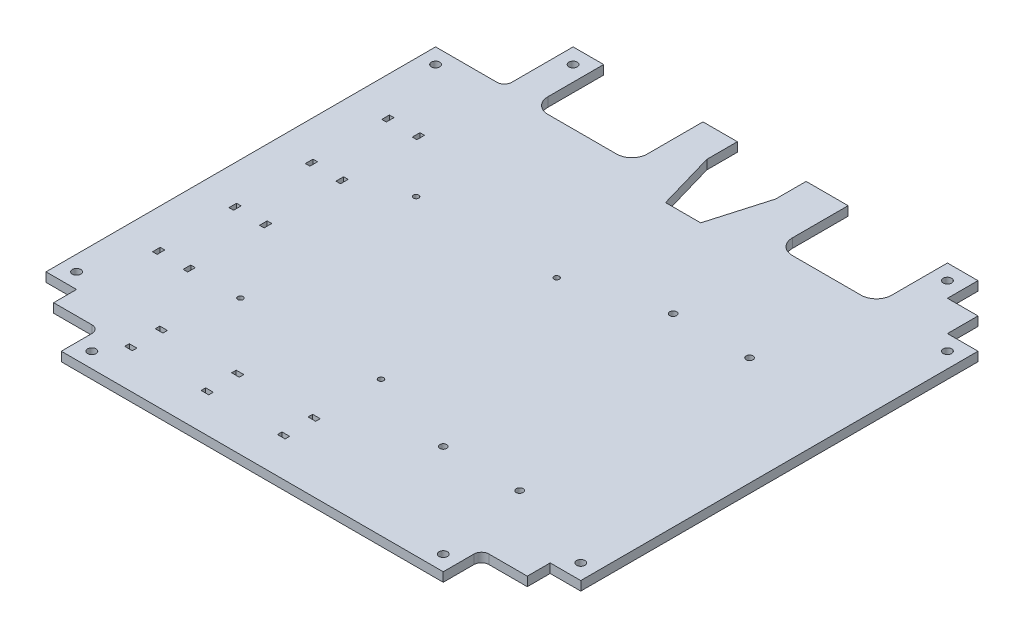
from build123d import *

# Parameters (mm, degrees)
SKETCH1_W            = 350
SKETCH1_H            = 340
BOSS_EXTRUDE1_DEPTH  = 6
CUT_EXTRUDE2_DEPTH   = 6
MIRROR2_COPY_1_DEPTH = 6
CUT_EXTRUDE3_DEPTH   = 6
SKETCH4_W            = 10
SKETCH4_H            = 82.256980738
CUT_EXTRUDE4_DEPTH   = 6
SKETCH5_R            = 2.25
SKETCH5_R_2          = 1.75
CUT_EXTRUDE5_DEPTH   = 6
SKETCH6_W            = 12
SKETCH6_H            = 9
CUT_EXTRUDE6_DEPTH   = 6
SKETCH8_W            = 5
SKETCH8_H            = 3
CUT_EXTRUDE7_DEPTH   = 6
LPATTERN1_COUNT      = 3
LPATTERN1_PITCH      = 50
SKETCH9_W            = 3
SKETCH9_H            = 5
CUT_EXTRUDE8_DEPTH   = 6
LPATTERN2_COUNT      = 4
LPATTERN2_PITCH      = 50
SKETCH10_W           = 30
SKETCH10_H           = 25
CUT_EXTRUDE9_DEPTH   = 6
SKETCH11_W           = 10
SKETCH11_H           = 51.49656536
CUT_EXTRUDE10_DEPTH  = 6
SKETCH12_W           = 45
SKETCH12_H           = 45
CUT_EXTRUDE11_DEPTH  = 6
FILLET2_R            = 4.9
SKETCH13_R           = 2.75
CUT_EXTRUDE12_DEPTH  = 6
SKETCH14_W           = 50
SKETCH14_H           = 20
SKETCH14_W_2         = 40
CUT_EXTRUDE13_DEPTH  = 10
FILLET4_R            = 5
FILLET5_R            = 5
SKETCH15_W           = 65
SKETCH15_H           = 46.515736948
CUT_EXTRUDE14_DEPTH  = 10
FILLET6_R            = 10


with BuildPart() as part:
    # Sketch1 → Boss-Extrude1 (new body)
    with BuildSketch(Plane(origin=(0, 0, 0), x_dir=(1, 0, 0), z_dir=(0, 1, 0))):
        Rectangle(SKETCH1_W, SKETCH1_H)
    extrude(amount=BOSS_EXTRUDE1_DEPTH)

    # Sketch2 → Cut-Extrude2 (cut)
    with BuildSketch(Plane(origin=(0, 6, 0), x_dir=(1, 0, 0), z_dir=(0, 1, 0))):
        Polygon((-175, -130), (-155, -130), (-155, -150), (-135, -150), (-135, -170), (-175, -170), align=None)
    cut_extrude2 = extrude(amount=-CUT_EXTRUDE2_DEPTH, mode=Mode.SUBTRACT)

    # Mirror1: Cut-Extrude2 across plane
    add(cut_extrude2.mirror(Plane.XY), mode=Mode.SUBTRACT)

    # Mirror2: Cut-Extrude2 across plane
    add(cut_extrude2.mirror(Plane(origin=(0, 0, 0), x_dir=(0, 0, 1), z_dir=(1, 0, 0))), mode=Mode.SUBTRACT)

    # Mirror2 copy 1 sketch → Mirror2 copy 1 (cut)
    with BuildSketch(Plane(origin=(0, 6, 0), x_dir=(-1, 0, 0), z_dir=(0, 1, 0))):
        Polygon((-175, -130), (-155, -130), (-155, -150), (-135, -150), (-135, -170), (-175, -170), align=None)
    extrude(amount=-MIRROR2_COPY_1_DEPTH, mode=Mode.SUBTRACT)

    # Sketch3 → Cut-Extrude3 (cut)
    with BuildSketch(Plane(origin=(0, 6, 0), x_dir=(1, 0, 0), z_dir=(0, 1, 0))):
        Polygon((-22.5, 170), (-22.5, 150), (-11.5, 112), (11.5, 112), (22.5, 150), (22.5, 170), align=None)
    extrude(amount=-CUT_EXTRUDE3_DEPTH, mode=Mode.SUBTRACT)

    # Sketch4 → Cut-Extrude4 (cut)
    with BuildSketch(Plane(origin=(0, 6, 0), x_dir=(1, 0, 0), z_dir=(0, 1, 0))):
        with Locations((-97.5, 165.128490369)):
            Rectangle(SKETCH4_W, SKETCH4_H)
        with Locations((97.5, 165.128490369)):
            Rectangle(SKETCH4_W, SKETCH4_H)
    extrude(amount=-CUT_EXTRUDE4_DEPTH, mode=Mode.SUBTRACT)

    # Sketch5 → Cut-Extrude5 (cut)
    with BuildSketch(Plane(origin=(0, 6, 0), x_dir=(1, 0, 0), z_dir=(0, 1, 0))):
        with Locations(Location((104, 51.5, 0), (0, 0, 270))):
            Circle(SKETCH5_R)
        with Locations(Location((104, -99, 0), (0, 0, 270))):
            Circle(SKETCH5_R)
        with Locations(Location((54, -99, 0), (0, 0, 270))):
            Circle(SKETCH5_R)
        with Locations(Location((54, 51.5, 0), (0, 0, 270))):
            Circle(SKETCH5_R)
        with Locations(Location((-4.5, 33.75, 0), (0, 0, 270))):
            Circle(SKETCH5_R_2)
        with Locations(Location((-4.5, -81.25, 0), (0, 0, 270))):
            Circle(SKETCH5_R_2)
        with Locations(Location((-96.5, -81.25, 0), (0, 0, 270))):
            Circle(SKETCH5_R_2)
        with Locations(Location((-96.5, 33.75, 0), (0, 0, 270))):
            Circle(SKETCH5_R_2)
    extrude(amount=-CUT_EXTRUDE5_DEPTH, mode=Mode.SUBTRACT)

    # Sketch6 → Cut-Extrude6 (cut)
    with BuildSketch(Plane(origin=(0, 6, 0), x_dir=(1, 0, 0), z_dir=(0, 1, 0))):
        with Locations((-97.5, 145.5)):
            Rectangle(SKETCH6_W, SKETCH6_H)
        with Locations((97.5, 145.5)):
            Rectangle(SKETCH6_W, SKETCH6_H)
    extrude(amount=-CUT_EXTRUDE6_DEPTH, mode=Mode.SUBTRACT)

    # Sketch8 → Cut-Extrude7 (cut)
    with BuildSketch(Plane(origin=(0, 6, 0), x_dir=(1, 0, 0), z_dir=(0, 1, 0))):
        with Locations((-4.5, -125)):
            Rectangle(SKETCH8_W, SKETCH8_H)
        with Locations((-4.5, -145)):
            Rectangle(SKETCH8_W, SKETCH8_H)
    cut_extrude7 = extrude(amount=-CUT_EXTRUDE7_DEPTH, mode=Mode.SUBTRACT)

    # LPattern1: Cut-Extrude7 ×3
    with Locations(*[(-i * LPATTERN1_PITCH, 0, 0) for i in range(1, LPATTERN1_COUNT)]):
        add(cut_extrude7, mode=Mode.SUBTRACT)

    # Sketch9 → Cut-Extrude8 (cut)
    with BuildSketch(Plane(origin=(0, 6, 0), x_dir=(1, 0, 0), z_dir=(0, 1, 0))):
        with Locations((-150, -81.25)):
            Rectangle(SKETCH9_W, SKETCH9_H)
        with Locations((-130, -81.25)):
            Rectangle(SKETCH9_W, SKETCH9_H)
    cut_extrude8 = extrude(amount=-CUT_EXTRUDE8_DEPTH, mode=Mode.SUBTRACT)

    # LPattern2: Cut-Extrude8 ×4
    with Locations(*[(0, 0, -i * LPATTERN2_PITCH) for i in range(1, LPATTERN2_COUNT)]):
        add(cut_extrude8, mode=Mode.SUBTRACT)

    # Sketch10 → Cut-Extrude9 (cut)
    with BuildSketch(Plane(origin=(0, 6, 0), x_dir=(1, 0, 0), z_dir=(0, 1, 0))):
        with Locations((140, -157.5)):
            Rectangle(SKETCH10_W, SKETCH10_H)
    cut_extrude9 = extrude(amount=-CUT_EXTRUDE9_DEPTH, mode=Mode.SUBTRACT)

    # Mirror3: Cut-Extrude9 across plane
    add(cut_extrude9.mirror(Plane(origin=(0, 0, 0), x_dir=(0, 0, 1), z_dir=(1, 0, 0))), mode=Mode.SUBTRACT)

    # Sketch11 → Cut-Extrude10 (cut)
    with BuildSketch(Plane(origin=(0, 6, 0), x_dir=(1, 0, 0), z_dir=(0, 1, 0))):
        with Locations((55, 165.74828268)):
            Rectangle(SKETCH11_W, SKETCH11_H)
    extrude(amount=-CUT_EXTRUDE10_DEPTH, mode=Mode.SUBTRACT)

    # Sketch12 → Cut-Extrude11 (cut)
    with BuildSketch(Plane(origin=(0, 6, 0), x_dir=(1, 0, 0), z_dir=(0, 1, 0))):
        with Locations((-152.5, 147.5)):
            Rectangle(SKETCH12_W, SKETCH12_H)
    extrude(amount=-CUT_EXTRUDE11_DEPTH, mode=Mode.SUBTRACT)

    # Fillet2
    fillet2_edges = [part.edges().sort_by_distance(p)[0] for p in [
        (125, 3, 145),
        (-125, 3, 145),
        (50, 3, -140),
        (60, 3, -140),
        (-130, 3, -125),
    ]]
    fillet(fillet2_edges, radius=FILLET2_R)

    # Sketch13 → Cut-Extrude12 (cut)
    with BuildSketch(Plane(origin=(0, 6, 0), x_dir=(1, 0, 0), z_dir=(0, 1, 0))):
        with Locations(Location((165, -120, 0), (0, 0, 270))):
            Circle(SKETCH13_R)
        with Locations(Location((165, 120, 0), (0, 0, 270))):
            Circle(SKETCH13_R)
        with Locations(Location((125, 160, 0), (0, 0, 270))):
            Circle(SKETCH13_R)
        with Locations(Location((-120, 160, 0), (0, 0, 270))):
            Circle(SKETCH13_R)
        with Locations(Location((-165, 115, 0), (0, 0, 270))):
            Circle(SKETCH13_R)
        with Locations(Location((-165, -120, 0), (0, 0, 270))):
            Circle(SKETCH13_R)
        with Locations(Location((-115, -160, 0), (0, 0, 270))):
            Circle(SKETCH13_R)
        with Locations(Location((115, -160, 0), (0, 0, 270))):
            Circle(SKETCH13_R)
    extrude(amount=-CUT_EXTRUDE12_DEPTH, mode=Mode.SUBTRACT)

    # Sketch14 → Cut-Extrude13 (cut)
    with BuildSketch(Plane(origin=(0, 6, 0), x_dir=(1, 0, 0), z_dir=(0, 1, 0))):
        with Locations((82.5, 160)):
            Rectangle(SKETCH14_W, SKETCH14_H)
        with Locations((-87.5, 160)):
            Rectangle(SKETCH14_W_2, SKETCH14_H)
    extrude(amount=-CUT_EXTRUDE13_DEPTH, mode=Mode.SUBTRACT)

    # Fillet4
    fillet4_edges = [part.edges().sort_by_distance(p)[0] for p in [
        (-102.5, 3, -124),
        (-92.5, 3, -124),
    ]]
    fillet(fillet4_edges, radius=FILLET4_R - 0.0001)  # a hair under: the kernel refuses the full size

    # Fillet5
    fillet5_edges = [part.edges().sort_by_distance(p)[0] for p in [
        (92.5, 3, -124),
        (102.5, 3, -124),
    ]]
    fillet(fillet5_edges, radius=FILLET5_R - 0.0001)  # a hair under: the kernel refuses the full size

    # Sketch15 → Cut-Extrude14 (cut)
    with BuildSketch(Plane(origin=(0, 0, 0), x_dir=(-1, 0, 0), z_dir=(0, -1, 0))):
        with Locations((77.5, 146.742131526)):
            Rectangle(SKETCH15_W, SKETCH15_H)
        with Locations((-82.5, 146.742131526)):
            Rectangle(SKETCH15_W, SKETCH15_H)
    extrude(amount=-CUT_EXTRUDE14_DEPTH, mode=Mode.SUBTRACT)

    # Fillet6
    fillet6_edges = [part.edges().sort_by_distance(p)[0] for p in [
        (-110, 3, -123.484263052),
        (-45, 3, -123.484263052),
        (50, 3, -123.484263052),
        (115, 3, -123.484263052),
    ]]
    fillet(fillet6_edges, radius=FILLET6_R)


solid = part.part
